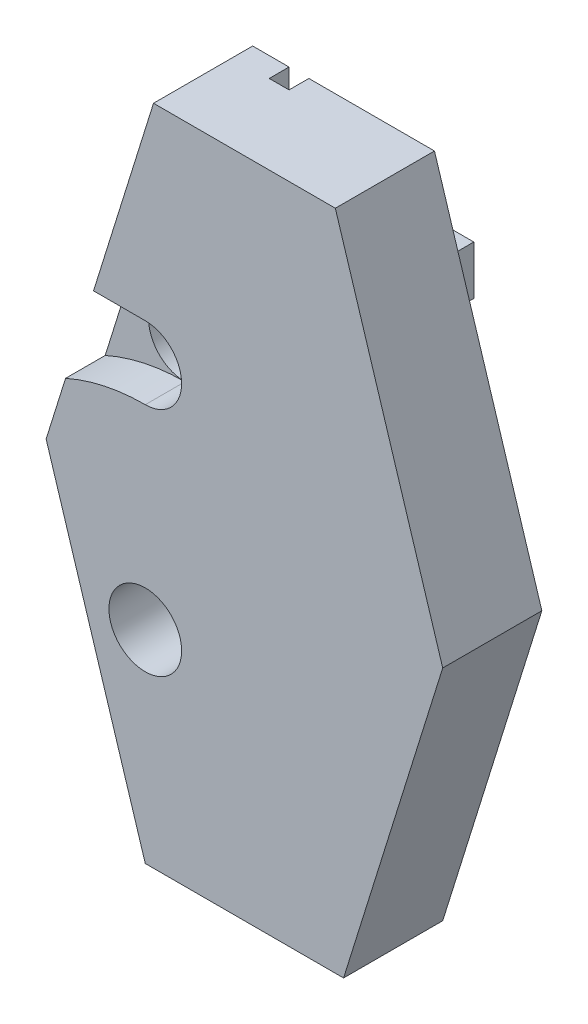
from build123d import *

# Parameters (mm, degrees)
BOSS_EXTRUDE1_DEPTH    = 15
SKETCH1_5_W            = 7.4
SKETCH1_5_H            = 7.4
BOSS_EXTRUDE2_DEPTH    = 7
CHAMFER1_SIZE          = 1
SKETCH2_R              = 9.708243919
SKETCH2_R_2            = 4
INNER_DISK_DEPTH       = 5
HOLE_DEPTH             = 65.033705881
HOLE_DEPTH_BACK        = 65.033705881
CUT_EXTRUDE5_DEPTH     = 6
CUT_EXTRUDE3_DEPTH     = 4
CUT_EXTRUDE4_START     = -8.25
CUT_EXTRUDE4_OUTLINE_W = 25.326781011
CUT_EXTRUDE4_OUTLINE_H = 3
CUT_EXTRUDE4_DEPTH     = 3


# Read off the part's stored shape, not the designer's step: Cut-Extrude4
with BuildPart() as part:
    # Sketch1 → Boss-Extrude1 (new body)
    with BuildSketch(Plane.XY):
        Polygon((30, 0), (13.753072731, 52.118283633), (-13.753072731, 52.118283633), (-30, 0), (-15, -48.118283633), (15, -48.118283633), align=None)
    extrude(amount=BOSS_EXTRUDE1_DEPTH)

    # Sketch1<5> → Boss-Extrude2 (add)
    with BuildSketch(Plane.XY):
        with Locations((10.003072731, 33.468283633)):
            Rectangle(SKETCH1_5_W, SKETCH1_5_H)
        with Locations((-11.25, -29.468283633)):
            Rectangle(SKETCH1_5_W, SKETCH1_5_H)
    extrude(amount=-BOSS_EXTRUDE2_DEPTH)

    # Chamfer1
    chamfer1_edges = [part.edges().sort_by_distance(p)[0] for p in [
        (10.003072731, 37.168283633, -7),
        (6.303072731, 33.468283633, -7),
        (13.703072731, 33.468283633, -7),
        (10.003072731, 29.768283633, -7),
        (-11.25, -33.168283633, -7),
        (-7.55, -29.468283633, -7),
        (-14.95, -29.468283633, -7),
        (-11.25, -25.768283633, -7),
    ]]
    chamfer(chamfer1_edges, length=CHAMFER1_SIZE)

    # Sketch2 → Inner Disk (cut)
    with BuildSketch(Plane(origin=(0, 0, 0), x_dir=(-1, 0, 0), z_dir=(0, 0, -1))):
        Circle(SKETCH2_R)
        Circle(SKETCH2_R_2, mode=Mode.SUBTRACT)
    extrude(amount=-INNER_DISK_DEPTH, mode=Mode.SUBTRACT)

    # Sketch3 → Hole (cut, two sides: drawn at the far end of the back side and taken through both)
    with BuildSketch(Plane.XY.offset(15).offset(-HOLE_DEPTH_BACK)):
        with BuildLine():
            ThreePointArc((-15, 23), (-20.5, 17.5), (-15, 12))
            Line((-15, 12), (-15, 17.5))
            Line((-15, 17.5), (-15, 23))
        make_face()
        with BuildLine():
            Line((-15, 17.5), (-15, 12))
            ThreePointArc((-15, 12), (-11.110912703, 13.610912703), (-9.5, 17.5))
            ThreePointArc((-9.5, 17.5), (-11.110912703, 21.389087297), (-15, 23))
            Line((-15, 23), (-15, 17.5))
        make_face()
        with BuildLine():
            ThreePointArc((-9.5, -17.5), (-11.110912703, -13.610912703), (-15, -12))
            Line((-15, -12), (-15, -17.5))
            Line((-15, -17.5), (-15, -23))
            ThreePointArc((-15, -23), (-11.110912703, -21.389087297), (-9.5, -17.5))
        make_face()
        with BuildLine():
            Line((-15, -17.5), (-15, -12))
            ThreePointArc((-15, -12), (-20.5, -17.5), (-15, -23))
            Line((-15, -23), (-15, -17.5))
        make_face()
    extrude(amount=HOLE_DEPTH + HOLE_DEPTH_BACK, mode=Mode.SUBTRACT)

    # Sketch3<3> → Cut-Extrude5 (cut)
    with BuildSketch(Plane.XY.offset(15)):
        with BuildLine():
            ThreePointArc((-27.063244683, 9.420775021), (-21.167946858, 11.347988345), (-15, 12))
            ThreePointArc((-15, 12), (-20.5, 17.5), (-15, 23))
            Line((-15, 23), (-22.830168203, 23))
            Line((-22.830168203, 23), (-27.063244683, 9.420775021))
        make_face()
    extrude(amount=-CUT_EXTRUDE5_DEPTH, mode=Mode.SUBTRACT)

    # Sketch4 → Cut-Extrude3 (cut)
    with BuildSketch(Plane(origin=(0, 0, 0), x_dir=(-1, 0, 0), z_dir=(0, 0, -1))):
        with BuildLine():
            Line((0, 9.708243919), (0, -2))
            Line((0, -2), (9.5, -2))
            ThreePointArc((9.5, -2), (9.656042596, -1.005406078), (9.708243919, 0))
            ThreePointArc((9.708243919, 0), (6.864765109, 6.864765109), (0, 9.708243919))
        make_face()
        with BuildLine():
            ThreePointArc((9.708243919, 0), (9.656042596, -1.005406078), (9.5, -2))
            Line((9.5, -2), (13.5, -2))
            Line((13.5, -2), (13.5, 12.208497378))
            ThreePointArc((13.5, 12.208497378), (9.5, 17.5), (13.5, 22.791502622))
            Line((13.5, 22.791502622), (13.5, 26.791502622))
            Line((13.5, 26.791502622), (8.25, 26.791502622))
            Line((8.25, 26.791502622), (5.25, 26.791502622))
            Line((5.25, 26.791502622), (0, 26.791502622))
            Line((0, 26.791502622), (0, 17.5))
            Line((0, 17.5), (0, 9.708243919))
            ThreePointArc((0, 9.708243919), (6.864765109, 6.864765109), (9.708243919, 0))
        make_face()
    extrude(amount=-CUT_EXTRUDE3_DEPTH, mode=Mode.SUBTRACT)

    # Cut-Extrude4 outline → Cut-Extrude4 (cut)
    with BuildSketch(Plane.YZ.offset(CUT_EXTRUDE4_START)):
        with Locations((39.454893128, 1.5)):
            Rectangle(CUT_EXTRUDE4_OUTLINE_W, CUT_EXTRUDE4_OUTLINE_H)
    extrude(amount=CUT_EXTRUDE4_DEPTH, mode=Mode.SUBTRACT)


solid = part.part
